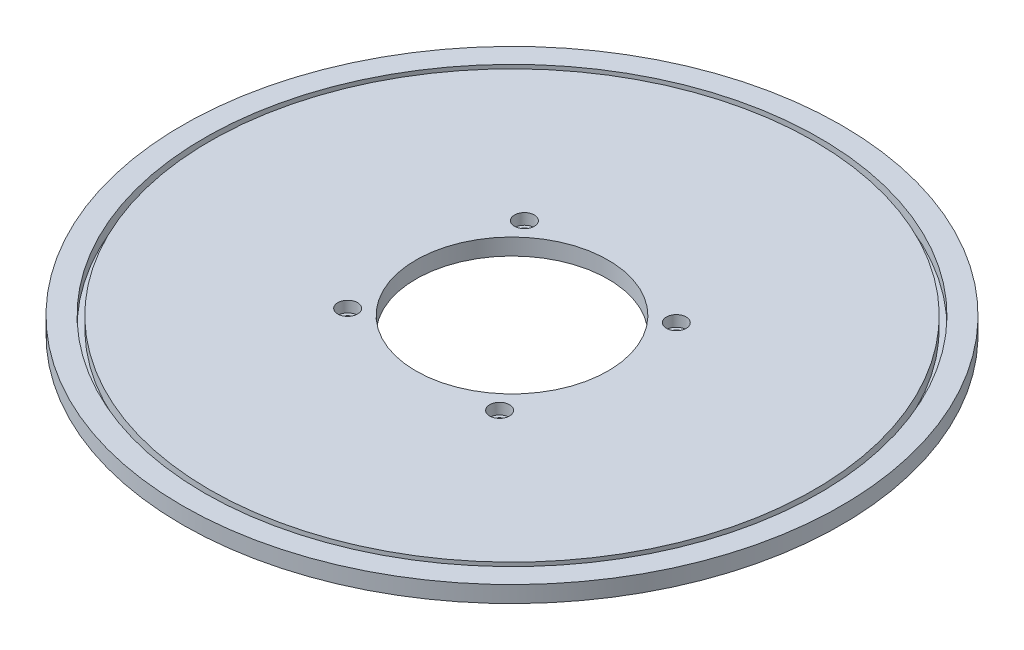
from build123d import *

# Parameters (mm, degrees)
SKETCH1_R                      = 300
PLATE_DEPTH                    = 15
SKETCH2_R                      = 87.5
BEARING_HOLE_DEPTH             = 425.529150943
SKETCH4_R                      = 280
SKETCH4_R_2                    = 275
CUT_EXTRUDE3_DEPTH             = 10
CBORE_FOR_M10_SHCS_D           = 12
CBORE_FOR_M10_SHCS_CBORE_D     = 18
CBORE_FOR_M10_SHCS_CBORE_DEPTH = 10


with BuildPart() as part:
    # Sketch1 → plate (new body)
    with BuildSketch(Plane(origin=(0, 0, 0), x_dir=(1, 0, 0), z_dir=(0, 1, 0))):
        Circle(SKETCH1_R)
    extrude(amount=PLATE_DEPTH)

    # Sketch2 → bearing-hole (cut, through all)
    with BuildSketch(Plane(origin=(0, 15, 0), x_dir=(1, 0, 0), z_dir=(0, 1, 0))):
        Circle(SKETCH2_R)
    extrude(amount=-BEARING_HOLE_DEPTH, mode=Mode.SUBTRACT)

    # Sketch4 → Cut-Extrude3 (cut)
    with BuildSketch(Plane(origin=(0, 15, 0), x_dir=(1, 0, 0), z_dir=(0, 1, 0))):
        Circle(SKETCH4_R)
        Circle(SKETCH4_R_2, mode=Mode.SUBTRACT)
    extrude(amount=-CUT_EXTRUDE3_DEPTH, mode=Mode.SUBTRACT)

    # CBORE for M10 SHCS (through all)
    with Locations(Plane(origin=(0, 15, 0), x_dir=(0.9971609611542523, 0, 0.0752995189222859), z_dir=(0, 1, 0))):
        with Locations((0, 0), (-75, 75), (75, 75), (75, -75), (-75, -75)):
            CounterBoreHole(CBORE_FOR_M10_SHCS_D / 2, CBORE_FOR_M10_SHCS_CBORE_D / 2, CBORE_FOR_M10_SHCS_CBORE_DEPTH)


solid = part.part
